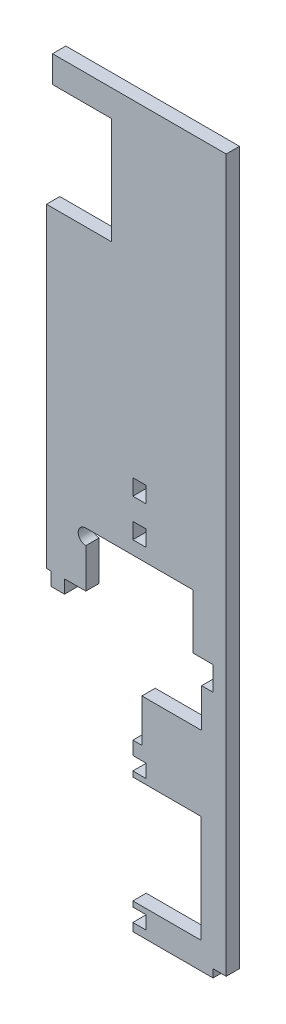
from build123d import *

# Parameters (mm, degrees)
BOSS_EXTRU_1_DEPTH      = 5
ESQUISSE2_R             = 2.8575
ESQUISSE2_W             = 5
ESQUISSE2_H             = 6
ESQUISSE2_W_2           = 4.274370263
ESQUISSE2_H_2           = 8.980069935
ESQUISSE2_W_3           = 4.92
ESQUISSE2_H_3           = 3
ENL_V_MAT_EXTRU_1_DEPTH = 5
ESQUISSE3_W             = 5
ESQUISSE3_H             = 5
BOSS_EXTRU_2_DEPTH      = 5


with BuildPart() as part:
    # Esquisse1 → Boss.-Extru.1 (new body)
    with BuildSketch(Plane.XY):
        Polygon((65.121094869, 0), (30.122364869, 0), (30.122364869, 3), (35.122364869, 3), (35.122364869, 8), (30.122364869, 8), (30.122364869, 10), (55.617614869, 10), (55.617614869, 50.2), (30.122364869, 50.2), (30.122364869, 52.2), (35.122364869, 52.2), (35.122364869, 57.2), (30.122364869, 57.2), (30.122364869, 62.2), (33.512280837, 62.2), (33.512280837, 78.240708175), (55.911629737, 78.240708175), (55.911629737, 101.750434868), (52.693, 101.750434868), (52.693, 122.246954868), (12.493, 122.246954868), (12.493, 101.750434868), (-2.259546173, 101.750434868), (-2.259546173, 220), (22.181004149, 220), (22.181004149, 260), (0, 260), (0, 270), (65.121094869, 270), align=None)
    extrude(amount=-BOSS_EXTRU_1_DEPTH)

    # Esquisse2 → Enlèv. mat.-Extru.1 (cut)
    with BuildSketch(Plane.XY):
        with Locations((12.493, 119.389454868)):
            Circle(ESQUISSE2_R)
        with Locations((32.622364869, 144.401636706)):
            Rectangle(ESQUISSE2_W, ESQUISSE2_H)
        with Locations((32.622364869, 130.246954868)):
            Rectangle(ESQUISSE2_W, ESQUISSE2_H)
        with Locations((58.048814869, 97.260399901)):
            Rectangle(ESQUISSE2_W_2, ESQUISSE2_H_2)
        with Locations((62.661094869, 1.5)):
            Rectangle(ESQUISSE2_W_3, ESQUISSE2_H_3)
    extrude(amount=-ENL_V_MAT_EXTRU_1_DEPTH, mode=Mode.SUBTRACT)

    # Esquisse3 → Boss.-Extru.2 (add)
    with BuildSketch(Plane.XY):
        with Locations((1.993, 99.250434868)):
            Rectangle(ESQUISSE3_W, ESQUISSE3_H)
    extrude(amount=-BOSS_EXTRU_2_DEPTH)


solid = part.part
